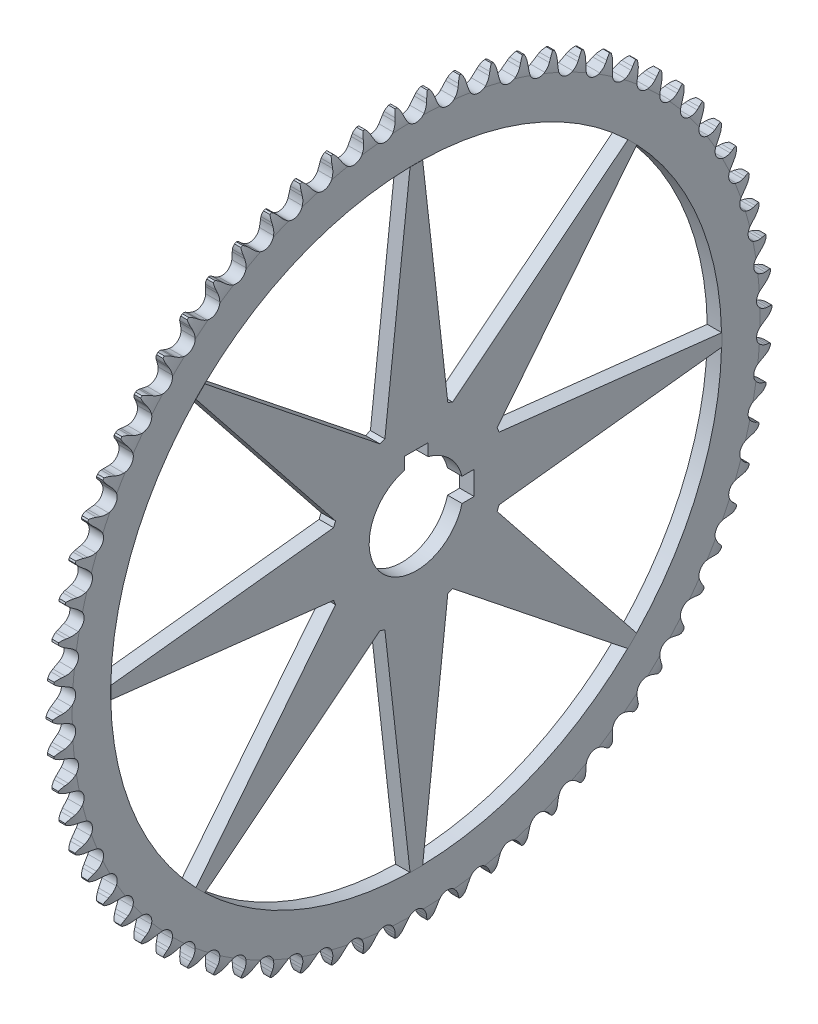
from build123d import *

# Parameters (mm, degrees)
TOOTHCUT_DEPTH          = 206.429666982
TEETHCUTS_COUNT         = 70
TEETHCUTS_ANGLE         = 354.857142857
HUBNEAONESKE_R          = 19.05
HUBNEARONE_DEPTH        = 0.85151468
BORSKE_R                = 19.05
BORE_DEPTH              = 5.7531508
KEYSKE_W                = 9.525
KEYSKE_H                = 23.3426
KEYWAY_DEPTH            = 5.7531508
KEYWAY2_COUNT           = 2
KEYWAY2_ANGLE           = 90
CUT_EXTRUDE6_DEPTH      = 36.576
CUT_EXTRUDE6_DEPTH_BACK = 18.542
SKETCH1_R               = 123.325174223
BOSS_EXTRUDE1_START     = -5.842
BOSS_EXTRUDE1_DEPTH     = 5.842


with BuildPart() as part:
    # BasProSke → Base-Revolve (revolve)
    with BuildSketch(Plane(origin=(0, 0, 0), x_dir=(1, 0, 0), z_dir=(0, 1, 0)), mode=Mode.PRIVATE) as base_revolve_sk:
        with BuildLine():
            Line((0, 0), (0, 138.853736034))
            ThreePointArc((0, 138.853736034), (0.399574234, 142.124916824), (1.5748, 145.203736034))
            Line((1.5748, 145.203736034), (4.1783, 145.203736034))
            ThreePointArc((4.1783, 145.203736034), (5.353525766, 142.124916824), (5.7531, 138.853736034))
            Line((5.7531, 138.853736034), (5.7531, 0))
            Line((5.7531, 0), (0, 0))
        make_face()
    revolve(base_revolve_sk.sketch.rotate(Axis((-10, 0, 0), (1, 0, 0)), 180), axis=Axis((-10, 0, 0), (1, 0, 0)))

    # TooCutSke → ToothCut (cut, through all)
    with BuildSketch(Plane(origin=(0, 0, 0), x_dir=(0, 0, -1), z_dir=(1, 0, 0))):
        with BuildLine():
            Line((4.588154598, 141.927744752), (4.964446875, 143.042196651))
            ThreePointArc((4.964446875, 143.042196651), (7.235406701, 146.112023023), (10.870403195, 147.281592595))
            ThreePointArc((10.870403195, 147.281592595), (0, 147.682203339), (-10.870403195, 147.281592595))
            ThreePointArc((-10.870403195, 147.281592595), (-7.235406701, 146.112023023), (-4.964446875, 143.042196651))
            Line((-4.964446875, 143.042196651), (-4.588154598, 141.927744752))
            ThreePointArc((-4.588154598, 141.927744752), (-3.993801891, 140.524620397), (-3.196315177, 139.226148974))
            ThreePointArc((-3.196315177, 139.226148974), (0, 137.592522623), (3.196315177, 139.226148974))
            ThreePointArc((3.196315177, 139.226148974), (3.993801891, 140.524620397), (4.588154598, 141.927744752))
        make_face()
    toothcut = extrude(amount=TOOTHCUT_DEPTH, mode=Mode.SUBTRACT)

    # TeethCuts: ToothCut ×70 about axis
    teethcuts_axis = Axis((-10, 0, 0), (1, 0, 0))
    for i in range(1, TEETHCUTS_COUNT):
        add(toothcut.rotate(teethcuts_axis, i * TEETHCUTS_ANGLE / (TEETHCUTS_COUNT - 1)), mode=Mode.SUBTRACT)

    # HubNeaOneSke → HubNearOne (add)
    with BuildSketch(Plane.ZY):
        with Locations(Location((0, 0, 0), (0, 0, 180))):
            Circle(HUBNEAONESKE_R)
    extrude(amount=HUBNEARONE_DEPTH)

    # BorSke → Bore (cut, symmetric)
    with BuildSketch(Plane(origin=(0, 0, 0), x_dir=(0, 0, -1), z_dir=(1, 0, 0))):
        with Locations(Location((0, 0, 0), (0, 0, 180))):
            Circle(BORSKE_R)
    extrude(amount=BORE_DEPTH, both=True, mode=Mode.SUBTRACT)

    # KeySke → Keyway (cut, symmetric)
    with BuildSketch(Plane(origin=(0, 0, 0), x_dir=(0, 0, -1), z_dir=(1, 0, 0))):
        with Locations((0, 11.6713)):
            Rectangle(KEYSKE_W, KEYSKE_H)
    keyway = extrude(amount=KEYWAY_DEPTH, both=True, mode=Mode.SUBTRACT)

    # Keyway2: Keyway ×2 about axis
    keyway2_axis = Axis((0, 0, 0), (-1, 0, 0))
    for i in range(1, KEYWAY2_COUNT):
        add(keyway.rotate(keyway2_axis, i * KEYWAY2_ANGLE / (KEYWAY2_COUNT - 1)), mode=Mode.SUBTRACT)

    # Sketch1 → Cut-Extrude6 (cut, two sides: drawn at the far end of the back side and taken through both)
    with BuildSketch(Plane.ZY.offset(-CUT_EXTRUDE6_DEPTH_BACK)):
        with Locations(Location((0, 0, 0), (0, 0, 180))):
            Circle(SKETCH1_R)
    extrude(amount=CUT_EXTRUDE6_DEPTH + CUT_EXTRUDE6_DEPTH_BACK, mode=Mode.SUBTRACT)

    # Boss-Extrude1: read off the stored shape, not the designer's step
    # Boss-Extrude1 outline → Boss-Extrude1 (add)
    with BuildSketch(Plane.ZY.offset(BOSS_EXTRUDE1_START)):
        with BuildLine():
            Line((32.602332361, 14.641820119), (88.98162055, 85.389518101))
            ThreePointArc((88.98162055, 85.389518101), (87.204066984, 87.204066984), (85.389518101, 88.98162055))
            Line((85.389518101, 88.98162055), (14.641820119, 32.602332361))
            ThreePointArc((14.641820119, 32.602332361), (13.676824113, 33.018774265), (12.7, 33.40666059))
            Line((12.7, 33.40666059), (2.549395591, 123.298820673))
            ThreePointArc((2.549395591, 123.298820673), (0.004698796, 123.325174134), (-2.54, 123.299014583))
            Line((-2.54, 123.299014583), (-12.7, 33.40666059))
            ThreePointArc((-12.7, 33.40666059), (-13.676824113, 33.018774265), (-14.641820119, 32.602332361))
            Line((-14.641820119, 32.602332361), (-85.389518101, 88.98162055))
            ThreePointArc((-85.389518101, 88.98162055), (-87.204066984, 87.204066984), (-88.98162055, 85.389518101))
            Line((-88.98162055, 85.389518101), (-32.602332361, 14.641820119))
            ThreePointArc((-32.602332361, 14.641820119), (-33.018774265, 13.676824113), (-33.40666059, 12.7))
            Line((-33.40666059, 12.7), (-123.299014583, 2.54))
            ThreePointArc((-123.299014583, 2.54), (-123.325174134, -0.004698796), (-123.298820673, -2.549395591))
            Line((-123.298820673, -2.549395591), (-33.40666059, -12.7))
            ThreePointArc((-33.40666059, -12.7), (-33.018774265, -13.676824113), (-32.602332361, -14.641820119))
            Line((-32.602332361, -14.641820119), (-88.98162055, -85.389518101))
            ThreePointArc((-88.98162055, -85.389518101), (-87.204066984, -87.204066984), (-85.389518101, -88.98162055))
            Line((-85.389518101, -88.98162055), (-14.641820119, -32.602332361))
            ThreePointArc((-14.641820119, -32.602332361), (-13.676824113, -33.018774265), (-12.7, -33.40666059))
            Line((-12.7, -33.40666059), (-2.549395591, -123.298820673))
            ThreePointArc((-2.549395591, -123.298820673), (-0.004698796, -123.325174134), (2.54, -123.299014583))
            Line((2.54, -123.299014583), (12.7, -33.40666059))
            ThreePointArc((12.7, -33.40666059), (13.676824113, -33.018774265), (14.641820119, -32.602332361))
            Line((14.641820119, -32.602332361), (85.389518101, -88.98162055))
            ThreePointArc((85.389518101, -88.98162055), (87.204066984, -87.204066984), (88.98162055, -85.389518101))
            Line((88.98162055, -85.389518101), (32.602332361, -14.641820119))
            ThreePointArc((32.602332361, -14.641820119), (33.018774265, -13.676824113), (33.40666059, -12.7))
            Line((33.40666059, -12.7), (123.299014583, -2.54))
            ThreePointArc((123.299014583, -2.54), (123.325174134, 0.004698796), (123.298820673, 2.549395591))
            Line((123.298820673, 2.549395591), (33.40666059, 12.7))
            ThreePointArc((33.40666059, 12.7), (33.018774265, 13.676824113), (32.602332361, 14.641820119))
        make_face()
        with BuildLine():
            ThreePointArc((4.7625, 18.445083186), (13.470384182, -13.470384182), (-18.445083186, -4.7625))
            Line((-18.445083186, -4.7625), (-23.3426, -4.7625))
            Line((-23.3426, -4.7625), (-23.3426, 4.7625))
            Line((-23.3426, 4.7625), (-18.445083186, 4.7625))
            ThreePointArc((-18.445083186, 4.7625), (-13.470384182, 13.470384182), (-4.7625, 18.445083186))
            Line((-4.7625, 18.445083186), (-4.7625, 23.3426))
            Line((-4.7625, 23.3426), (4.7625, 23.3426))
            Line((4.7625, 23.3426), (4.7625, 18.445083186))
        make_face(mode=Mode.SUBTRACT)
    extrude(amount=BOSS_EXTRUDE1_DEPTH)


solid = part.part
